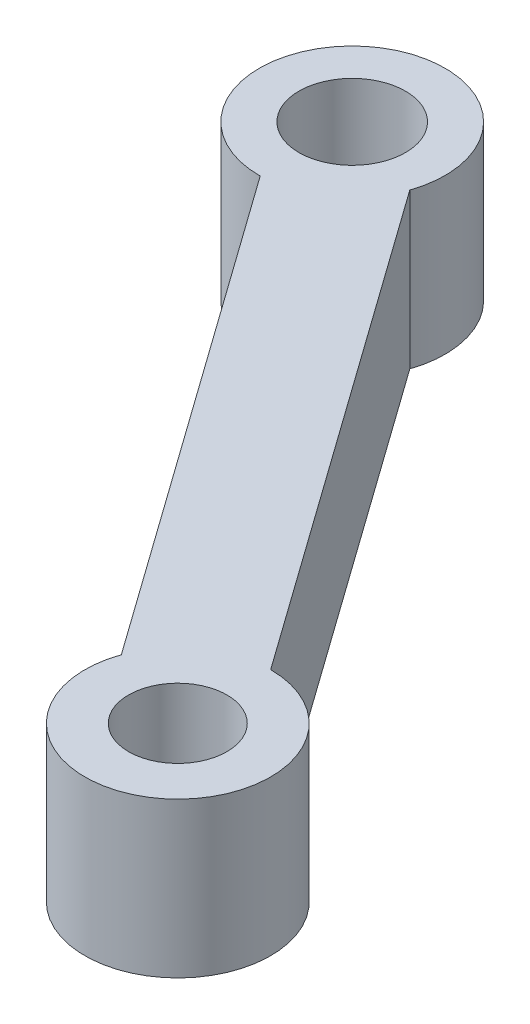
from build123d import *

# Parameters (mm, degrees)
CROQUIS2_R              = 1.720307827
CROQUIS2_R_2            = 1.5875
SALIENTE_EXTRUIR1_DEPTH = 5


with BuildPart() as part:
    # Croquis2 → Saliente-Extruir1 (new body)
    with BuildSketch(Plane(origin=(0, 0, 0), x_dir=(1, 0, 0), z_dir=(0, 1, 0))):
        with BuildLine():
            Line((50.028646758, 40.030488864), (61.173158874, 24.402199283))
            ThreePointArc((61.173158874, 24.402199283), (65.730112158, 20.946865244), (64, 26.397724669))
            Line((64, 26.397724669), (52.836303892, 42.052916548))
            ThreePointArc((52.836303892, 42.052916548), (48.246563662, 45.464579071), (50.028646758, 40.030488864))
        make_face()
        with Locations((50, 43.030352088)):
            Circle(CROQUIS2_R, mode=Mode.SUBTRACT)
        with Locations((64, 23.397724669)):
            Circle(CROQUIS2_R_2, mode=Mode.SUBTRACT)
    extrude(amount=-SALIENTE_EXTRUIR1_DEPTH)


solid = part.part
